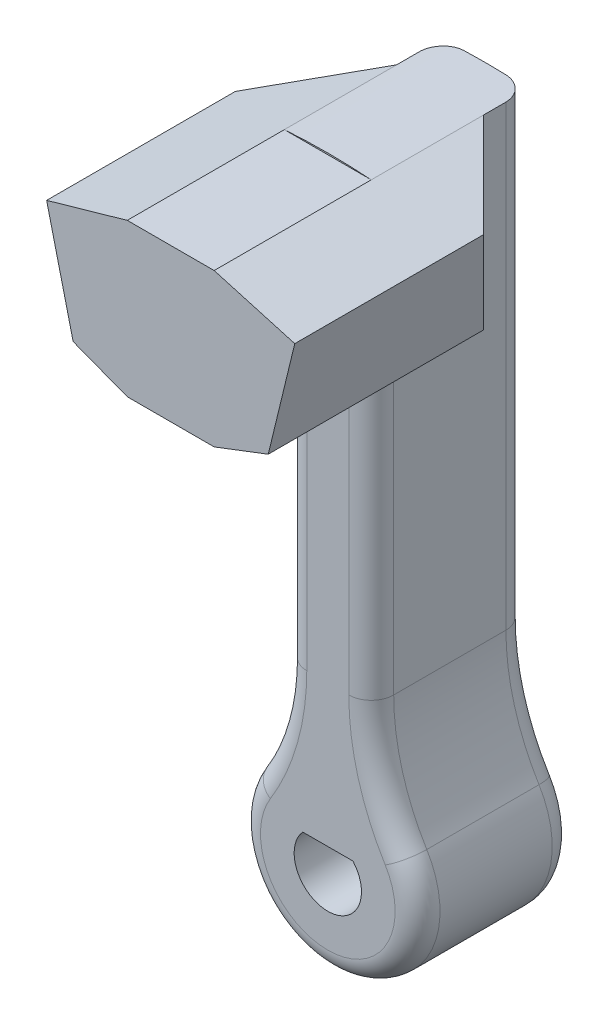
from build123d import *

# Parameters (mm, degrees)
SALIENTE_EXTRUIR1_DEPTH = 7
SALIENTE_EXTRUIR2_DEPTH = 7
SALIENTE_EXTRUIR3_DEPTH = 7
REDONDEO1_R             = 10
REDONDEO2_R             = 1
REDONDEO3_R             = 1
CHAFL_N1_SIZE           = 5


with BuildPart() as part:
    # Croquis1 → Saliente-Extruir1 (new body)
    with BuildSketch(Plane.XY.offset(21.250000099)):
        with BuildLine():
            Line((-25.316388353, -1.516889614), (-29.189371699, -1.516889614))
            ThreePointArc((-29.189371699, -1.516889614), (-27.252880026, -9.016889614), (-25.316388353, -1.516889614))
        make_face()
        with BuildLine():
            Line((-26.134846038, -4.016889614), (-28.370914015, -4.016889614))
            ThreePointArc((-28.370914015, -4.016889614), (-27.252880026, -6.516889614), (-26.134846038, -4.016889614))
        make_face(mode=Mode.SUBTRACT)
    extrude(amount=-SALIENTE_EXTRUIR1_DEPTH)

    # Croquis2 → Saliente-Extruir2 (add)
    with BuildSketch(Plane(origin=(0, 0, 14.250000099), x_dir=(-1, 0, 0), z_dir=(0, 0, -1))):
        with BuildLine():
            Line((25.316388353, -1.516889614), (25.316388353, 22.676611236))
            ThreePointArc((25.316388353, 22.676611236), (27.252880026, 22.744234091), (29.189371699, 22.676611236))
            Line((29.189371699, 22.676611236), (29.189371699, -1.516889614))
            Line((29.189371699, -1.516889614), (25.316388353, -1.516889614))
        make_face()
    extrude(amount=-SALIENTE_EXTRUIR2_DEPTH)

    # Croquis3 → Saliente-Extruir3 (add)
    with BuildSketch(Plane(origin=(0, 0, 21.250000099), x_dir=(-1, 0, 0), z_dir=(0, 0, -1))):
        Polygon((25.316388353, 22.676611236), (21.724816583, 21.651922087), (22.905873651, 16.793413653), (25.316388353, 15.869973518), (29.189371699, 15.869973518), (31.599886401, 16.793413653), (32.780943469, 21.651922087), (29.189371699, 22.676611236), align=None)
    extrude(amount=-SALIENTE_EXTRUIR3_DEPTH)

    # Redondeo1
    redondeo1_edges = [part.edges().sort_by_distance(p)[0] for p in [
        (-29.189371699, -1.516889614, 17.750000099),
        (-25.316388353, -1.516889614, 17.750000099),
    ]]
    fillet(redondeo1_edges, radius=REDONDEO1_R)

    # Redondeo2
    redondeo2_edges = [part.edges().sort_by_distance(p)[0] for p in [
        (-25.316388353, 12.487734734, 14.250000099),
        (-29.189371699, 12.487734734, 14.250000099),
        (-27.252880026, -9.016889614, 14.250000099),
        (-29.564906654, -0.415855859, 14.250000099),
        (-24.940853398, -0.415855859, 14.250000099),
    ]]
    fillet(redondeo2_edges, radius=REDONDEO2_R)

    # Redondeo3
    # the kernel refuses this fillet: 1 mm, written as the material it takes off along each edge
    with BuildSketch(Plane(origin=(-25.316388353, 2.298858232, 21.250000099), x_dir=(-1, 0, 0), z_dir=(0, 1, 0)), Plane(origin=(-29.189371699, 15.869973518, 21.250000099), x_dir=(1, 0, 0), z_dir=(0, -1, 0))) as redondeo3_piece_1:
        with BuildLine():
            CenterArc((REDONDEO3_R, -REDONDEO3_R), REDONDEO3_R, 90, 90)
            Line((0, -REDONDEO3_R), (0, 0))
            Line((0, 0), (REDONDEO3_R, 0))
        make_face()
    extrude(amount=13.571115286, mode=Mode.SUBTRACT)
    with BuildSketch(Plane(origin=(-27.252880026, -5.016889614, 21.250000099), x_dir=(-0.8526065480788361, 0.5225534175307739, 0), z_dir=(0.5225534175307739, 0.8526065480788361, 0))) as redondeo3_piece_2:
        with BuildLine():
            CenterArc((4 - REDONDEO3_R, -REDONDEO3_R), REDONDEO3_R, 0, 90)
            Line((4 - REDONDEO3_R, 0), (4, 0))
            Line((4, 0), (4, -REDONDEO3_R))
        make_face()
    revolve(axis=Axis((-27.252880026, -5.016889614, 21.250000099), (0, 0, 1)), revolution_arc=243.007372153, mode=Mode.SUBTRACT)
    with BuildSketch(Plane(origin=(-39.189371699, 2.298858232, 21.250000099), x_dir=(0.8526065480788363, -0.5225534175307737, 0), z_dir=(-0.5225534175307737, -0.8526065480788363, 0))) as redondeo3_piece_3:
        with BuildLine():
            CenterArc((10 + REDONDEO3_R, -REDONDEO3_R), REDONDEO3_R, 90, 90)
            Line((10 + REDONDEO3_R, 0), (10, 0))
            Line((10, 0), (10, -REDONDEO3_R))
        make_face()
    revolve(axis=Axis((-39.189371699, 2.298858232, 21.250000099), (0, 0, 1)), revolution_arc=31.503686076, mode=Mode.SUBTRACT)
    with BuildSketch(Plane(origin=(-15.316388353, 2.298858232, 21.250000099), x_dir=(-0.8526065480788363, -0.5225534175307737, 0), z_dir=(0.5225534175307737, -0.8526065480788363, 0))) as redondeo3_piece_4:
        with BuildLine():
            CenterArc((10 + REDONDEO3_R, REDONDEO3_R), REDONDEO3_R, 180, 90)
            Line((10, REDONDEO3_R), (10, 0))
            Line((10, 0), (10 + REDONDEO3_R, 0))
        make_face()
    revolve(axis=Axis((-15.316388353, 2.298858232, 21.250000099), (0, 0, -1)), revolution_arc=31.503686076, mode=Mode.SUBTRACT)

    # Chaflán1
    # the kernel refuses this chamfer: 5 mm, written as the material it adds along each edge
    with BuildSketch(Plane(origin=(-25.316388353, 3.011558578, 21.250000099), x_dir=(-0.027495876610586317, 0, -0.9996219169112968), z_dir=(0, 1, 0))) as chafl_n1_piece_1_section:
        Polygon((CHAFL_N1_SIZE * 0.999621916911, -CHAFL_N1_SIZE * 0.0274958766106), (-CHAFL_N1_SIZE * 0.0274958766106, -CHAFL_N1_SIZE * 0.999621916911), (0, 0), align=None)
    chafl_n1_piece_1 = extrude(amount=32.523467598, mode=Mode.PRIVATE)
    chafl_n1_piece_1 = chafl_n1_piece_1 & Plane(origin=(-27.252880026, -5.016889614, 17.716506235), x_dir=(0.06975552192119414, 0.997564116817311, 0), z_dir=(0, 0, -1)) * Cylinder(27.761123704, 86, mode=Mode.PRIVATE)
    chafl_n1_piece_1 = split(chafl_n1_piece_1, bisect_by=Plane(origin=(-25.415963135, 15.831827578, 17.716506235), z_dir=(-0.35773655396653403, 0.9338225516425211, 0)), keep=Keep.TOP, mode=Mode.PRIVATE)
    chafl_n1_piece_1 = split(chafl_n1_piece_1, bisect_by=Plane(origin=(-23.262937497, 15.32456193, 17.716506235), z_dir=(-0.9717016867786622, 0.23621141359278705, 0)), keep=Keep.TOP, mode=Mode.PRIVATE)
    chafl_n1_piece_1 = split(chafl_n1_piece_1, bisect_by=Plane(origin=(-23.613600886, 22.190799465, 17.716506235), z_dir=(-0.2743561835557756, -0.9616281425502842, 0)), keep=Keep.TOP, mode=Mode.PRIVATE)
    add(chafl_n1_piece_1)
    with BuildSketch(Plane(origin=(-29.189371699, 35.535026176, 21.250000099), x_dir=(0.027495876610586317, 0, -0.9996219169112968), z_dir=(0, -1, 0))) as chafl_n1_piece_2_section:
        Polygon((CHAFL_N1_SIZE * 0.999621916911, -CHAFL_N1_SIZE * 0.0274958766106), (-CHAFL_N1_SIZE * 0.0274958766106, -CHAFL_N1_SIZE * 0.999621916911), (0, 0), align=None)
    chafl_n1_piece_2 = extrude(amount=32.523467598, mode=Mode.PRIVATE)
    chafl_n1_piece_2 = chafl_n1_piece_2 & Plane(origin=(-27.252880026, -5.016889614, 19.332721103), x_dir=(0.06975552192119414, 0.997564116817311, 0), z_dir=(0, 0, -1)) * Cylinder(27.761123704, 86, mode=Mode.PRIVATE)
    chafl_n1_piece_2 = split(chafl_n1_piece_2, bisect_by=Plane(origin=(-31.36247481, 16.702464034, 19.332721103), z_dir=(0.35773655396653403, 0.9338225516425211, 0)), keep=Keep.TOP, mode=Mode.PRIVATE)
    chafl_n1_piece_2 = split(chafl_n1_piece_2, bisect_by=Plane(origin=(-31.108304124, 22.129132483, 19.332721103), z_dir=(0.2743561835557751, -0.9616281425502844, 0)), keep=Keep.TOP, mode=Mode.PRIVATE)
    chafl_n1_piece_2 = split(chafl_n1_piece_2, bisect_by=Plane(origin=(-32.12707836, 18.962120521, 19.332721103), z_dir=(0.9717016867786619, 0.2362114135927884, 0)), keep=Keep.TOP, mode=Mode.PRIVATE)
    add(chafl_n1_piece_2)


solid = part.part
